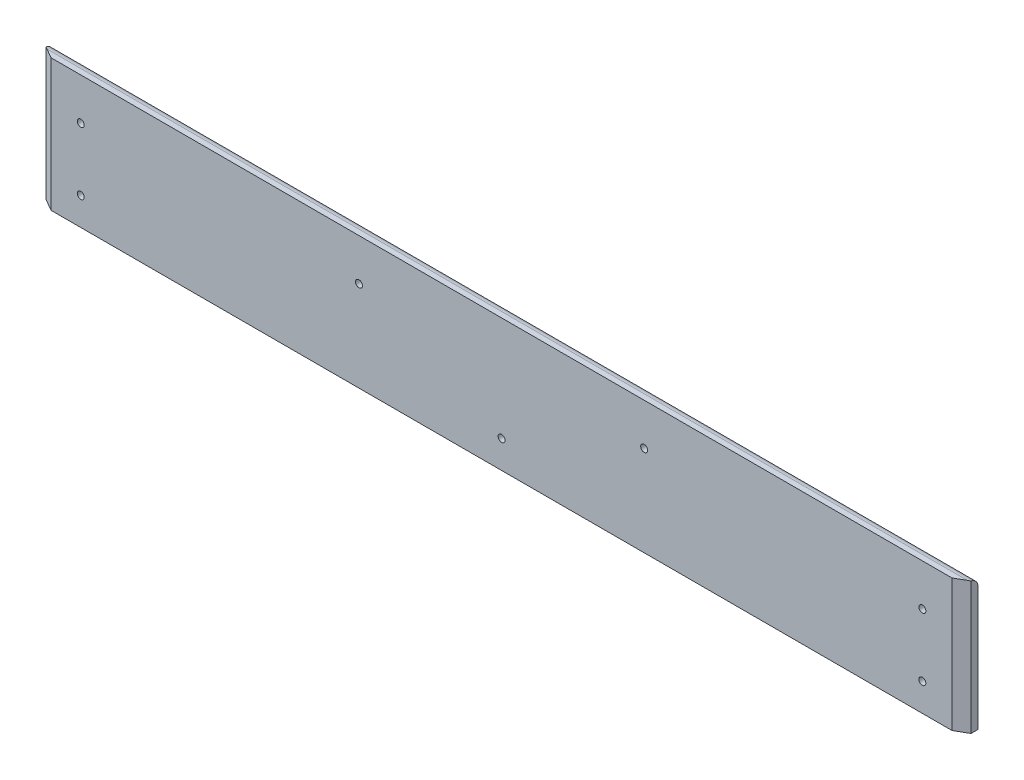
from build123d import *
from OCP.BRepFilletAPI import BRepFilletAPI_MakeChamfer

# Parameters (mm, degrees)
SKETCH_1_W          = 665
SKETCH_1_H          = 95
EXTRUDE_1_DEPTH     = 5
FILLET_1_R          = 6
CHAMFER_1_SIZE      = 5
CHAMFER_1_SIZE2     = 8.660254038
SKETCH_3_R          = 2.5
CUT_EXTRUDE_1_DEPTH = 337.024552674
CHAMFER_2_SIZE      = 2


with BuildPart() as part:
    # Эскиз1 → Бобышка-Вытянуть1 (new, symmetric)
    with BuildSketch(Plane.XY):
        Rectangle(SKETCH_1_W, SKETCH_1_H)
    extrude(amount=EXTRUDE_1_DEPTH, both=True)

    # Скругление1
    fillet_1_edges = [part.edges().sort_by_distance(p)[0] for p in [
        (0, 47.5, -5),
    ]]
    fillet(fillet_1_edges, radius=FILLET_1_R)

    # Фаска1: one chamfer whose edges measure the first distance from different faces: ONE call of the kernel's chamfer builder (chamfer() names one face for all edges)
    chamfer_1_edges_1 = [part.edges().sort_by_distance(p)[0] for p in [
        (332.5, 0, 5),
    ]]
    chamfer_1_side_1 = [part.faces().sort_by_distance(p)[0] for p in [
        (332.5, -0.378462122, 0.030006478),
    ]]
    chamfer_1_edges_2 = [part.edges().sort_by_distance(p)[0] for p in [
        (-332.5, 0, 5),
    ]]
    chamfer_1_side_2 = [part.faces().sort_by_distance(p)[0] for p in [
        (-332.5, -0.378462122, 0.030006478),
    ]]
    chamfer_1 = BRepFilletAPI_MakeChamfer(part.part.solid().wrapped)
    for e in chamfer_1_edges_1:
        chamfer_1.Add(CHAMFER_1_SIZE, CHAMFER_1_SIZE2, e.wrapped, chamfer_1_side_1[0].wrapped)  # the first distance lies on this face
    for e in chamfer_1_edges_2:
        chamfer_1.Add(CHAMFER_1_SIZE, CHAMFER_1_SIZE2, e.wrapped, chamfer_1_side_2[0].wrapped)  # the first distance lies on this face
    add(Compound.cast(chamfer_1.Shape()), mode=Mode.REPLACE)

    # Эскиз3 → Вырез-Вытянуть1 (cut, through all)
    with BuildSketch(Plane.XY.offset(5)):
        with Locations((-302.5, -27.5)):
            Circle(SKETCH_3_R)
        with Locations((0, -27.5)):
            Circle(SKETCH_3_R)
        with Locations((302.5, -27.5)):
            Circle(SKETCH_3_R)
        with Locations((-302.5, 17.5)):
            Circle(SKETCH_3_R)
        with Locations((302.5, 17.5)):
            Circle(SKETCH_3_R)
        with Locations((-102.5, 17.5)):
            Circle(SKETCH_3_R)
        with Locations((102.5, 17.5)):
            Circle(SKETCH_3_R)
    extrude(amount=-CUT_EXTRUDE_1_DEPTH, mode=Mode.SUBTRACT)

    # Фаска2
    chamfer_2_edges = [part.edges().sort_by_distance(p)[0] for p in [
        (-305, -27.5, -5),
        (-305, 17.5, -5),
        (-105, 17.5, -5),
        (-2.5, -27.5, -5),
        (100, 17.5, -5),
        (300, -27.5, -5),
        (300, 17.5, -5),
    ]]
    chamfer(chamfer_2_edges, length=CHAMFER_2_SIZE)


solid = part.part
